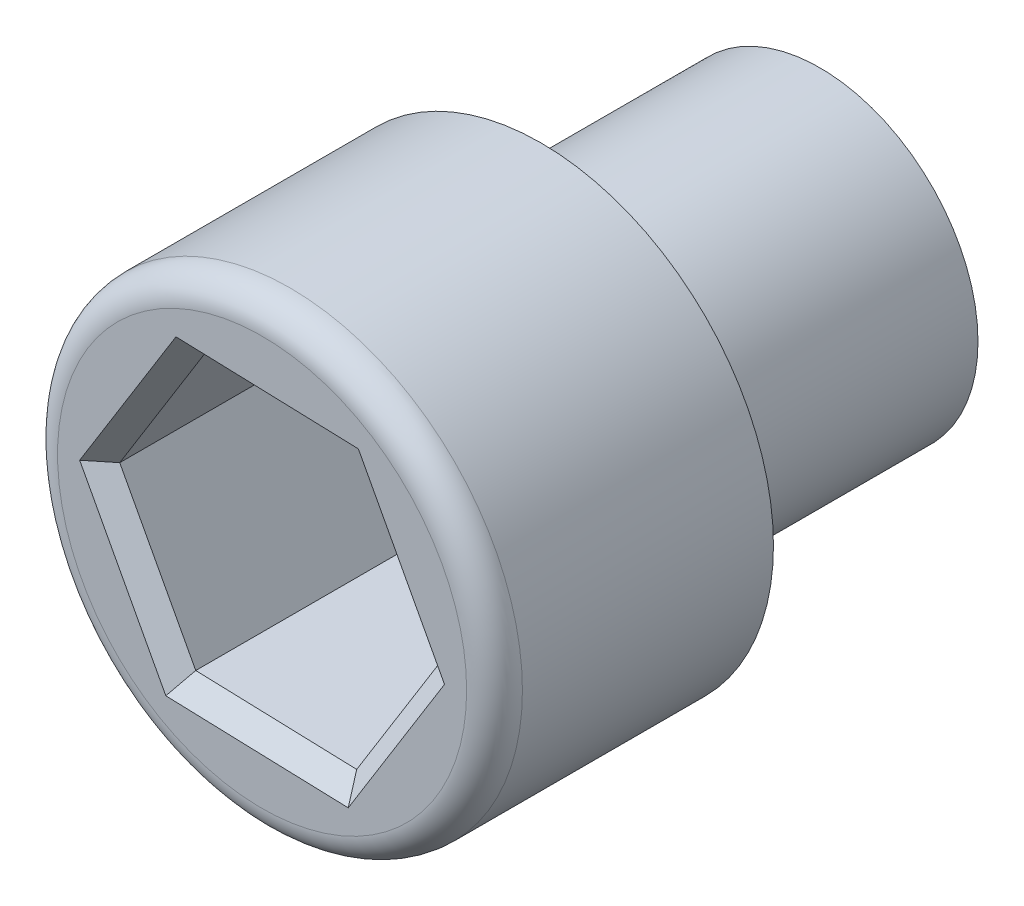
from build123d import *

# Parameters (mm, degrees)
SZKIC1_R                    = 1.7
DODANIE_WYCI_GNI_CIE1_DEPTH = 3
SZKIC2_R                    = 2.5
DODANIE_WYCI_GNI_CIE2_DEPTH = 3
ZAOKR_GLENIE1_R             = 0.3
WYTNIJ_WYCI_GNI_CIE1_DEPTH  = 3
SFAZOWANIE1_SIZE            = 0.2


with BuildPart() as part:
    # Szkic1 → Dodanie-wyciągnięcie1 (new body)
    with BuildSketch(Plane.XY):
        Circle(SZKIC1_R)
    extrude(amount=DODANIE_WYCI_GNI_CIE1_DEPTH)

    # Szkic2 → Dodanie-wyciągnięcie2 (add)
    with BuildSketch(Plane.XY.offset(3)):
        Circle(SZKIC2_R)
    extrude(amount=DODANIE_WYCI_GNI_CIE2_DEPTH)

    # Zaokrąglenie1
    zaokr_glenie1_edges = [part.edges().sort_by_distance(p)[0] for p in [
        (-2.5, 0, 6),
    ]]
    fillet(zaokr_glenie1_edges, radius=ZAOKR_GLENIE1_R)

    # Szkic3 → Wytnij-wyciągnięcie1 (cut)
    with BuildSketch(Plane.XY.offset(6)):
        Polygon((-0.817437581, 1.527021873), (-1.731158525, 0.055589226), (-0.913720944, -1.471432648), (0.817437581, -1.527021873), (1.731158525, -0.055589226), (0.913720944, 1.471432648), align=None)
    extrude(amount=-WYTNIJ_WYCI_GNI_CIE1_DEPTH, mode=Mode.SUBTRACT)

    # Sfazowanie1
    sfazowanie1_edges = [part.edges().sort_by_distance(p)[0] for p in [
        (-0.048141682, -1.49922726, 6),
        (-1.322439734, -0.707921711, 6),
        (-1.274298053, 0.79130555, 6),
        (0.048141682, 1.49922726, 6),
        (1.322439734, 0.707921711, 6),
        (1.274298053, -0.79130555, 6),
    ]]
    chamfer(sfazowanie1_edges, length=SFAZOWANIE1_SIZE)


solid = part.part
